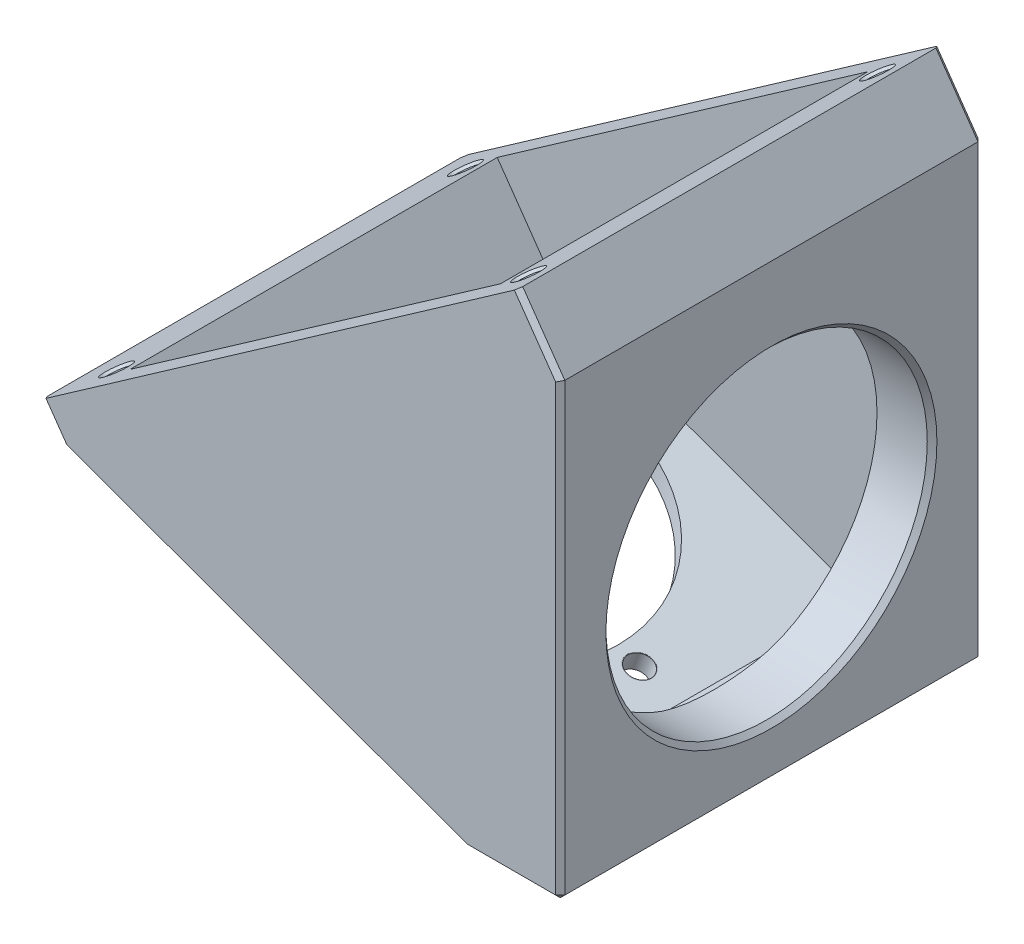
from build123d import *

# Parameters (mm, degrees)
P_IDAT_VYSUNUT_M1_DEPTH                     = 20
P_IDAT_VYSUNUT_M2_DEPTH                     = 3
V_LCOV_START                                = -141.407290306
V_LCOV_ZAHLOUBEN_PRO_M2_5_ROUBY_S_2_R       = 1.35
V_LCOV_ZAHLOUBEN_PRO_M2_5_ROUBY_S_VNI_DEPTH = 2
V_LCOV_START_2                              = -139.417290306
V_LCOV_ZAHLOUBEN_PRO_M2_5_ROUBY_S_3_O_R     = 1.4
V_LCOV_ZAHLOUBEN_PRO_M2_5_ROUBY_S_3_O_R_2   = 1.35
V_LCOV_ZAHLOUBEN_PRO_M2_5_ROUBY_S_3_DEPTH   = 0.01
SKICA13_W                                   = 63.2698
SKICA13_H                                   = 46
SKICA13_W_2                                 = 49.2698
SKICA13_H_2                                 = 40
ODEBRAT_VYSUNUT_M1_DEPTH                    = 3
M3_Z_VIT2_D                                 = 2.5
M3_Z_VIT2_DEPTH                             = 5.5
M3_Z_VIT2_CSINK_D                           = 3.05
M3_Z_VIT2_CSINK_ANGLE                       = 90
M3_Z_VIT2_TIP                               = 0.751075774
M3_Z_VIT2_ON_FACE_2_D                       = 2.5
M3_Z_VIT2_ON_FACE_2_DEPTH                   = 5.5
M3_Z_VIT2_ON_FACE_2_CSINK_D                 = 3.05
M3_Z_VIT2_ON_FACE_2_CSINK_ANGLE             = 90
M3_Z_VIT2_ON_FACE_2_TIP                     = 0.751075774
M3_Z_VIT2_ON_FACE_3_D                       = 2.5
M3_Z_VIT2_ON_FACE_3_DEPTH                   = 5.5
M3_Z_VIT2_ON_FACE_3_CSINK_D                 = 3.05
M3_Z_VIT2_ON_FACE_3_CSINK_ANGLE             = 90
M3_Z_VIT2_ON_FACE_3_TIP                     = 0.751075774
ZKOSEN_1_SIZE                               = 0.5
ZAOBLIT1_R                                  = 5


# Read off the part's stored shape, not the designer's step: Válcové zahloubení pro M2.5 šrouby s vnitřním šestihranem1
with BuildPart() as part:
    # Skica2 → Přidat vysunutím1 (new, symmetric)
    with BuildSketch(Plane.XY):
        Polygon((-340.05, -23), (-350.255276964, -23), (-394.120989631, -7.034186284), (-398.184656118, -1.23066909), (-391.631439764, 3.357942401), (-383.014556922, -8.948241654), (-350.233285651, -20.879648638), (-346.05, -20.879648638), (-346.05, 24.160174988), (-351.271982372, 31.617938704), (-346.357070106, 35.059397322), (-340.05, 26.051967722), align=None)
    extrude(amount=P_IDAT_VYSUNUT_M1_DEPTH, both=True)

    # Skica3 → Přidat vysunutím2 (add)
    with BuildSketch(Plane.XY.offset(20)):
        Polygon((-346.357070106, 35.059397322), (-340.05, 26.051967722), (-340.05, -23), (-350.255276964, -23), (-394.120989631, -7.034186284), (-398.184656118, -1.23066909), align=None)
    p_idat_vysunut_m2 = extrude(amount=P_IDAT_VYSUNUT_M2_DEPTH)

    # Zrcadlit1: Přidat vysunutím2 across plane
    add(p_idat_vysunut_m2.mirror(Plane.XY))

    # Skica6 → M36x1.0 závit1 (revolve, cut)
    with BuildSketch(Plane(origin=(-340.05, 0, 0), x_dir=(0, 0, -1), z_dir=(0, 1, 0))):
        Polygon((0, 0), (0, 6), (17.5, 6), (17.5, 0.525), (18.025, 0), align=None)
    revolve(axis=Axis((-333.7, 0, 0), (-1, 0, 0)), mode=Mode.SUBTRACT)

    # Skica8 → Ø32.0 (32) průměr díry1 (revolve, cut)
    with BuildSketch(Plane(origin=(-372.477448122, -14.911791158, 0), x_dir=(0.9396926207859314, -0.34202014332560576, 0), z_dir=(0, 0, 1))):
        Polygon((0, 0), (0, 15.613769904), (16, 6), (16, 0.025), (16.025, 0), align=None)
    revolve(axis=Axis((-374.649276032, -20.8788393, 0), (0.3420201433256057, 0.9396926207859314, 0)), mode=Mode.SUBTRACT)

    # V_lcov_ zahlouben_ pro M2.5 _rouby s 2 → Válcové zahloubení pro M2.5 šrouby s vnitřním šestihranem1 (cut)
    with BuildSketch(Plane(origin=(0, 0, 0), x_dir=(0.9396926207859079, -0.34202014332566993, 0), z_dir=(0.34202014332567, 0.939692620785908, 0)).offset(V_LCOV_START)):
        with Locations((-352.732614303, 16.76669406)):
            Circle(V_LCOV_ZAHLOUBEN_PRO_M2_5_ROUBY_S_2_R)
        with Locations((-352.732614303, -16.76669406)):
            Circle(V_LCOV_ZAHLOUBEN_PRO_M2_5_ROUBY_S_2_R)
        with Locations((-326.41417646, 0)):
            Circle(V_LCOV_ZAHLOUBEN_PRO_M2_5_ROUBY_S_2_R)
    extrude(amount=V_LCOV_ZAHLOUBEN_PRO_M2_5_ROUBY_S_VNI_DEPTH, mode=Mode.SUBTRACT)

    # V_lcov_ zahlouben_ pro M2.5 _rouby s 3 o → V_lcov_ zahlouben_ pro M2.5 _rouby s 3 (cut)
    # profile 1 of 3: a face of its own
    with BuildSketch(Plane(origin=(0, 0, 0), x_dir=(0.9396926207859079, -0.34202014332566993, 0), z_dir=(0.34202014332567, 0.939692620785908, 0)).offset(V_LCOV_START_2)):
        with Locations((-352.732614303, 16.76669406)):
            Circle(V_LCOV_ZAHLOUBEN_PRO_M2_5_ROUBY_S_3_O_R)
        with Locations((-352.732614303, 16.76669406)):
            Circle(V_LCOV_ZAHLOUBEN_PRO_M2_5_ROUBY_S_3_O_R_2, mode=Mode.SUBTRACT)
    # profile 2 of 3: a face of its own
    with BuildSketch(Plane(origin=(0, 0, 0), x_dir=(0.9396926207859079, -0.34202014332566993, 0), z_dir=(0.34202014332567, 0.939692620785908, 0)).offset(V_LCOV_START_2)):
        with Locations((-352.732614303, -16.76669406)):
            Circle(V_LCOV_ZAHLOUBEN_PRO_M2_5_ROUBY_S_3_O_R)
        with Locations((-352.732614303, -16.76669406)):
            Circle(V_LCOV_ZAHLOUBEN_PRO_M2_5_ROUBY_S_3_O_R_2, mode=Mode.SUBTRACT)
    # profile 3 of 3: a face of its own
    with BuildSketch(Plane(origin=(0, 0, 0), x_dir=(0.9396926207859079, -0.34202014332566993, 0), z_dir=(0.34202014332567, 0.939692620785908, 0)).offset(V_LCOV_START_2)):
        with Locations((-326.41417646, 0)):
            Circle(V_LCOV_ZAHLOUBEN_PRO_M2_5_ROUBY_S_3_O_R)
        with Locations((-326.41417646, 0)):
            Circle(V_LCOV_ZAHLOUBEN_PRO_M2_5_ROUBY_S_3_O_R_2, mode=Mode.SUBTRACT)
    extrude(amount=V_LCOV_ZAHLOUBEN_PRO_M2_5_ROUBY_S_3_DEPTH, mode=Mode.SUBTRACT)

    # Skica13 → Odebrat vysunutím1 (cut)
    with BuildSketch(Plane(origin=(-130.42051615, 186.259800178, 0), x_dir=(0.8191520442889952, 0.5735764363510412, 0), z_dir=(-0.5735764363510412, 0.8191520442889952, 0))):
        with Locations((-295.244757855, 0)):
            Rectangle(SKICA13_W, SKICA13_H)
        with Locations((-294.244757855, 0)):
            Rectangle(SKICA13_W_2, SKICA13_H_2, mode=Mode.SUBTRACT)
    extrude(amount=-ODEBRAT_VYSUNUT_M1_DEPTH, mode=Mode.SUBTRACT)

    # M3 závit2
    with Locations(Plane(origin=(-392.368166588, -0.820243041, 19), x_dir=(0.819152044289, 0.573576436351, 0), z_dir=(-0.573576436351, 0.819152044289, 0))):
        with Locations((0, 0)):
            CounterSinkHole(M3_Z_VIT2_D / 2, M3_Z_VIT2_CSINK_D / 2, depth=M3_Z_VIT2_DEPTH, counter_sink_angle=M3_Z_VIT2_CSINK_ANGLE)
            with Locations((0, 0, -(M3_Z_VIT2_DEPTH + M3_Z_VIT2_TIP / 2))):  # 118° drill point
                Cone(0, M3_Z_VIT2_D / 2, M3_Z_VIT2_TIP, mode=Mode.SUBTRACT)

    # M3 závit2 on face 2
    with Locations(Plane(origin=(-347.503372952, 30.594423662, -19), x_dir=(0.819152234736, 0.573576164364, 0), z_dir=(-0.573576164364, 0.819152234736, 0))):
        with Locations((0, 0), (0, -38)):
            CounterSinkHole(M3_Z_VIT2_ON_FACE_2_D / 2, M3_Z_VIT2_ON_FACE_2_CSINK_D / 2, depth=M3_Z_VIT2_ON_FACE_2_DEPTH, counter_sink_angle=M3_Z_VIT2_ON_FACE_2_CSINK_ANGLE)
            with Locations((0, 0, -(M3_Z_VIT2_ON_FACE_2_DEPTH + M3_Z_VIT2_ON_FACE_2_TIP / 2))):  # 118° drill point
                Cone(0, M3_Z_VIT2_ON_FACE_2_D / 2, M3_Z_VIT2_ON_FACE_2_TIP, mode=Mode.SUBTRACT)

    # M3 závit2 on face 3
    with Locations(Plane(origin=(-392.368166588, -0.820243041, -19), x_dir=(0.819152234736, 0.573576164364, 0), z_dir=(-0.573576164364, 0.819152234736, 0))):
        with Locations((0, 0)):
            CounterSinkHole(M3_Z_VIT2_ON_FACE_3_D / 2, M3_Z_VIT2_ON_FACE_3_CSINK_D / 2, depth=M3_Z_VIT2_ON_FACE_3_DEPTH, counter_sink_angle=M3_Z_VIT2_ON_FACE_3_CSINK_ANGLE)
            with Locations((0, 0, -(M3_Z_VIT2_ON_FACE_3_DEPTH + M3_Z_VIT2_ON_FACE_3_TIP / 2))):  # 118° drill point
                Cone(0, M3_Z_VIT2_ON_FACE_3_D / 2, M3_Z_VIT2_ON_FACE_3_TIP, mode=Mode.SUBTRACT)

    # Zkosení1
    zkosen_1_edges = [part.edges().sort_by_distance(p)[0] for p in [
        (-342.343170399, 29.326954456, -23),
        (-342.343170399, 29.326954456, 23),
        (-340.05, -23, 0),
        (-395.29245822, -5.361155754, 23),
        (-372.188133297, -15.017093142, 23),
        (-345.152638482, -23, 23),
        (-340.05, 1.525983861, 23),
        (-395.29245822, -5.361155754, -23),
        (-340.05, 1.525983861, -23),
        (-345.152638482, -23, -23),
        (-372.188133297, -15.017093142, -23),
    ]]
    chamfer(zkosen_1_edges, length=ZKOSEN_1_SIZE)

    # Zaoblit1
    # the kernel refuses this fillet: 5 mm, written as the material it adds along each edge
    with BuildSketch(Plane(origin=(-346.05, -20.879648638, 20), x_dir=(-1, 0, 0), z_dir=(0, 0, -1))) as zaoblit1_piece_1_section:
        with BuildLine():
            CenterArc((5, 4.932846812), ZAOBLIT1_R, 180, 80.599018085)
            Line((0, 4.932846812), (-0.1, 4.932846812))
            Line((-0.1, 4.932846812), (-0.1, 0))
            Line((-0.1, 0), (0, -0.1))
            ThreePointArc((0, -0.1), (2.091642826, -0.1), (4.166951364, -0.098656936))
            Line((4.166951364, -0.098656936), (4.183285651, 0))
        make_face()
    zaoblit1_piece_1 = extrude(amount=40, mode=Mode.PRIVATE)
    zaoblit1_piece_1 = zaoblit1_piece_1 - Plane(origin=(-347.091511424, 0, 0), x_dir=(0, 0, -1), z_dir=(1, 0, 0)) * Cylinder(17.5, 100, mode=Mode.PRIVATE)
    add(zaoblit1_piece_1)


solid = part.part
